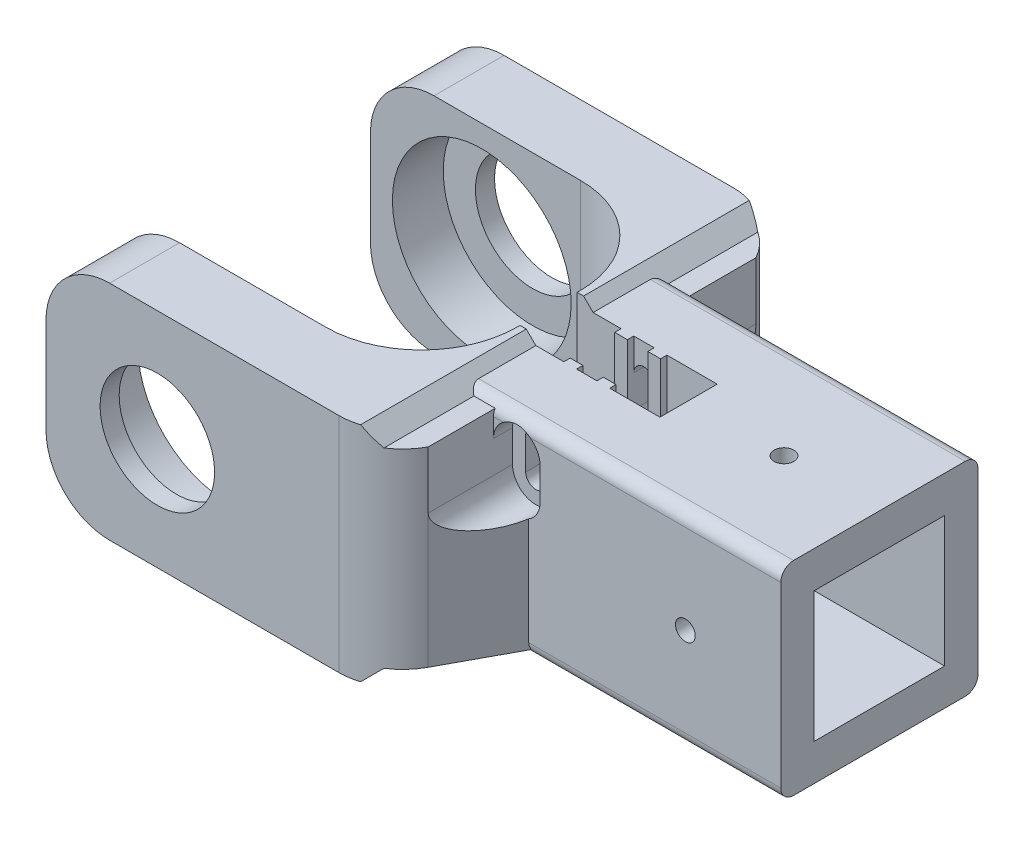
from build123d import *

# Parameters (mm, degrees)
SCHIZZO11_W                              = 14.5
SCHIZZO11_H                              = 15
ESTRUSIONE_ESTRUSIONE4_DEPTH             = 29
SCHIZZO12_W                              = 20.5
SCHIZZO12_H                              = 20.5
TAGLIO_ESTRUSIONE5_DEPTH                 = 31
SCHIZZO13_R                              = 1.5
TAGLIO_ESTRUSIONE6_DEPTH                 = 47.489246068
TAGLIO_ESTRUSIONE7_DEPTH                 = 39.551913052
TAGLIO_ESTRUSIONE7_DEPTH_BACK            = 39.551913052
SCHIZZO14_R                              = 1.5
RACCORDO6_R                              = 2
SCHIZZO15_W                              = 62
SCHIZZO15_H                              = 35
ESTRUSIONE_ESTRUSIONE5_DEPTH             = 2
SCHIZZO16_W                              = 11
SCHIZZO16_H                              = 35
ESTRUSIONE_ESTRUSIONE6_DEPTH             = 50
SCHIZZO19_R                              = 14.05
TAGLIO_ESTRUSIONE8_DEPTH                 = 8
TAGLIO_ESTRUSIONE9_DEPTH                 = 89.755281533
TAGLIO_ESTRUSIONE9_DEPTH_BACK            = 89.755281533
SCHIZZO20_R                              = 9
ESTRUSIONE_ESTRUSIONE7_DEPTH             = 35
ESTRUSIONE_ESTRUSIONE8_REACH             = 91.982
SMUSSO1_SIZE                             = 3
RACCORDO8_R                              = 10
RACCORDO9_R                              = 10
SCHIZZO24_W                              = 31
SCHIZZO24_H                              = 32
SCHIZZO24_W_2                            = 20.5
SCHIZZO24_H_2                            = 20.5
ESTRUSIONE_ESTRUSIONE9_DEPTH             = 15
ESTRUSIONE_ESTRUSIONE9_DIRECTION_2_REACH = 99.987
TAGLIO_ESTRUSIONE11_DEPTH                = 91.347938549
TAGLIO_ESTRUSIONE11_DEPTH_BACK           = 91.347938549
SCHIZZO25_R                              = 1.55
TAGLIO_ESTRUSIONE12_DEPTH                = 87.248188387
TAGLIO_ESTRUSIONE12_DEPTH_BACK           = 87.248188387
SCHIZZO26_R                              = 1.55
ESTRUSIONE_ESTRUSIONE10_DEPTH            = 25.75
SCHIZZO32_W                              = 22
SCHIZZO32_H                              = 32
ESTRUSIONE_ESTRUSIONE11_DEPTH            = 31
TAGLIO_ESTRUSIONE10_DEPTH                = 4.5
TAGLIO_ESTRUSIONE10_DEPTH_BACK           = 4.5
TAGLIO_ESTRUSIONE13_DEPTH                = 87.248188387
TAGLIO_ESTRUSIONE13_DEPTH_BACK           = 87.248188387
SCHIZZO29_R                              = 1.6
TAGLIO_ESTRUSIONE14_DEPTH                = 87.248188387
TAGLIO_ESTRUSIONE14_DEPTH_BACK           = 2
TAGLIO_ESTRUSIONE15_DEPTH                = 87.248188387
TAGLIO_ESTRUSIONE15_DEPTH_BACK           = 3
SCHIZZO33_W                              = 7.329913886
SCHIZZO33_H                              = 6.5
TAGLIO_ESTRUSIONE16_DEPTH                = 87.248188387
SCHIZZO34_W                              = 2
SCHIZZO34_H                              = 13.664956943
ESTRUSIONE_ESTRUSIONE12_DEPTH            = 1
RACCORDO10_R                             = 2


with BuildPart() as part:
    # Schizzo11 → Estrusione-Estrusione4 (new body)
    with BuildSketch(Plane.XY):
        Polygon((-14.5, 15), (14.5, -15), (-14.5, -15), (-20.5, -15), (-20.5, 15), align=None)
        Polygon((0, 15), (-14.5, 15), (0, 0), align=None)
        with Locations((7.25, 7.5)):
            Rectangle(SCHIZZO11_W, SCHIZZO11_H)
        Polygon((14.5, 0), (0, 0), (14.5, -15), align=None)
    extrude(amount=ESTRUSIONE_ESTRUSIONE4_DEPTH)

    # Schizzo12 → Taglio-Estrusione5 (cut)
    with BuildSketch(Plane(origin=(14.5, 0, 0), x_dir=(0, 0, -1), z_dir=(1, 0, 0))):
        with Locations((-14.5, 0)):
            Rectangle(SCHIZZO12_W, SCHIZZO12_H)
    extrude(amount=-TAGLIO_ESTRUSIONE5_DEPTH, mode=Mode.SUBTRACT)

    # Schizzo13 → Taglio-Estrusione6 (cut, through all)
    with BuildSketch(Plane.XZ.offset(15)):
        with Locations(Location((0, 14.5, 0), (0, 0, 270))):
            Circle(SCHIZZO13_R)
    extrude(amount=-TAGLIO_ESTRUSIONE6_DEPTH, mode=Mode.SUBTRACT)

    # Schizzo14 → Taglio-Estrusione7 (cut, two sides: drawn at the far end of the back side and taken through both)
    with BuildSketch(Plane.XY.offset(29).offset(-TAGLIO_ESTRUSIONE7_DEPTH_BACK)):
        Circle(SCHIZZO14_R)
    extrude(amount=TAGLIO_ESTRUSIONE7_DEPTH + TAGLIO_ESTRUSIONE7_DEPTH_BACK, mode=Mode.SUBTRACT)

    # Raccordo6
    raccordo6_edges = [part.edges().sort_by_distance(p)[0] for p in [
        (-3, 15, 29),
        (-3, -15, 29),
        (-3, -15, 0),
        (-3, 15, 0),
    ]]
    fillet(raccordo6_edges, radius=RACCORDO6_R)

    # Schizzo15 → Estrusione-Estrusione5 (add)
    with BuildSketch(Plane.ZY.offset(20.5)):
        with Locations((14.5, 0)):
            Rectangle(SCHIZZO15_W, SCHIZZO15_H)
    extrude(amount=-ESTRUSIONE_ESTRUSIONE5_DEPTH)

    # Schizzo16 → Estrusione-Estrusione6 (add)
    with BuildSketch(Plane.ZY.offset(20.5)):
        with Locations((-11, 0)):
            Rectangle(SCHIZZO16_W, SCHIZZO16_H)
        with Locations((40, 0)):
            Rectangle(SCHIZZO16_W, SCHIZZO16_H)
    extrude(amount=ESTRUSIONE_ESTRUSIONE6_DEPTH)

    # Schizzo19 → Taglio-Estrusione8 (cut)
    with BuildSketch(Plane(origin=(0, 0, 34.5), x_dir=(-1, 0, 0), z_dir=(0, 0, -1))):
        with Locations((53, 0)):
            Circle(SCHIZZO19_R)
    taglio_estrusione8 = extrude(amount=-TAGLIO_ESTRUSIONE8_DEPTH, mode=Mode.SUBTRACT)

    # Schizzo20 → Taglio-Estrusione9 (cut, two sides: drawn at the far end of the back side and taken through both)
    with BuildSketch(Plane(origin=(0, 0, 34.5), x_dir=(-1, 0, 0), z_dir=(0, 0, -1)).offset(-TAGLIO_ESTRUSIONE9_DEPTH_BACK)):
        with Locations((53, 0)):
            Circle(SCHIZZO20_R)
    extrude(amount=TAGLIO_ESTRUSIONE9_DEPTH + TAGLIO_ESTRUSIONE9_DEPTH_BACK, mode=Mode.SUBTRACT)

    # Specchia1: Taglio-Estrusione8 across plane
    add(taglio_estrusione8.mirror(Plane(origin=(0, 0, 14.5), x_dir=(1, 0, 0), z_dir=(0, 0, -1))), mode=Mode.SUBTRACT)

    # Schizzo21 → Estrusione-Estrusione7 (add)
    with BuildSketch(Plane.XZ.offset(17.5)):
        with BuildLine():
            ThreePointArc((-37.5, 34.5), (-26.893398282, 30.106601718), (-22.5, 19.5))
            Line((-22.5, 19.5), (-22.5, 34.5))
            Line((-22.5, 34.5), (-37.5, 34.5))
        make_face()
        with BuildLine():
            Line((-37.5, -5.5), (-22.5, -5.5))
            Line((-22.5, -5.5), (-22.5, 9.5))
            ThreePointArc((-22.5, 9.5), (-26.893398282, -1.106601718), (-37.5, -5.5))
        make_face()
        Polygon((-22.5, 9.5), (-22.5, -5.5), (-20.5, -5.5), (-20.5, 34.5), (-22.5, 34.5), (-22.5, 19.5), align=None)
    extrude(amount=-ESTRUSIONE_ESTRUSIONE7_DEPTH)

    # Estrusione-Estrusione8: up to this face of the body (flat: up to its plane)
    estrusione_estrusione8_end = Plane(part.part.faces().sort_by_distance((-2.017284049, 15, 14.5))[0])
    # Schizzo22 → Estrusione-Estrusione8 (add, up to the picked face)
    with BuildSketch(Plane.XZ.offset(15), mode=Mode.PRIVATE) as estrusione_estrusione8_sk1:
        Polygon((-18.5, 27), (-8.5, 27), (-18.5, 45.5), align=None)
    estrusione_estrusione8_tool1 = split(extrude(estrusione_estrusione8_sk1.sketch, amount=-ESTRUSIONE_ESTRUSIONE8_REACH, mode=Mode.PRIVATE), bisect_by=estrusione_estrusione8_end, keep=Keep.BOTH, mode=Mode.PRIVATE)
    # Schizzo22 → Estrusione-Estrusione8 (add, up to the picked face)
    with BuildSketch(Plane.XZ.offset(15), mode=Mode.PRIVATE) as estrusione_estrusione8_sk2:
        Polygon((-18.5, 2), (-18.5, -16.5), (-8.5, 2), align=None)
    estrusione_estrusione8_tool2 = split(extrude(estrusione_estrusione8_sk2.sketch, amount=-ESTRUSIONE_ESTRUSIONE8_REACH, mode=Mode.PRIVATE), bisect_by=estrusione_estrusione8_end, keep=Keep.BOTH, mode=Mode.PRIVATE)
    add(estrusione_estrusione8_tool1.solids().sort_by(Axis((-15.166667, -15, 33.166667), (0, 1, 0)))[0])
    add(estrusione_estrusione8_tool2.solids().sort_by(Axis((-15.166667, -15, -4.166667), (0, 1, 0)))[0])

    # Smusso1
    # the kernel refuses this chamfer: 3 mm, written as the material it takes off along each edge
    with BuildSketch(Plane(origin=(-18.5, -17.5, 53.215048964), x_dir=(-0.9996219169112965, -0.02749587661058676, 0), z_dir=(0, 0, -1))) as smusso1_piece_1_section:
        Polygon((SMUSSO1_SIZE * 0.999621916911, SMUSSO1_SIZE * 0.0274958766106), (-SMUSSO1_SIZE * 0.0274958766106, SMUSSO1_SIZE * 0.999621916911), (0, 0), align=None)
    smusso1_piece_1 = extrude(amount=77.430097928, mode=Mode.PRIVATE)
    smusso1_piece_1 = split(smusso1_piece_1, bisect_by=Plane(origin=(-19.526079574, -15, 14.5), z_dir=(0, -1, 0)), keep=Keep.TOP, mode=Mode.PRIVATE)
    add(smusso1_piece_1, mode=Mode.SUBTRACT)
    with BuildSketch(Plane(origin=(-18.5, 17.5, -24.215048964), x_dir=(-0.9996219169112965, 0.02749587661058676, 0), z_dir=(0, 0, 1))) as smusso1_piece_2_section:
        Polygon((SMUSSO1_SIZE * 0.999621916911, SMUSSO1_SIZE * 0.0274958766106), (-SMUSSO1_SIZE * 0.0274958766106, SMUSSO1_SIZE * 0.999621916911), (0, 0), align=None)
    smusso1_piece_2 = extrude(amount=77.430097928, mode=Mode.PRIVATE)
    smusso1_piece_2 = split(smusso1_piece_2, bisect_by=Plane(origin=(-19.526079574, 15, 14.5), z_dir=(0, 1, 0)), keep=Keep.TOP, mode=Mode.PRIVATE)
    add(smusso1_piece_2, mode=Mode.SUBTRACT)

    # Raccordo8
    raccordo8_edges = [part.edges().sort_by_distance(p)[0] for p in [
        (-18.5, 0, 45.5),
        (-18.5, 0, -16.5),
    ]]
    fillet(raccordo8_edges, radius=RACCORDO8_R)

    # Raccordo9
    raccordo9_edges = [part.edges().sort_by_distance(p)[0] for p in [
        (-70.5, -17.5, -11),
        (-70.5, 17.5, -11),
        (-70.5, 17.5, 40),
        (-70.5, -17.5, 40),
    ]]
    fillet(raccordo9_edges, radius=RACCORDO9_R)

    # Schizzo24 → Estrusione-Estrusione9 (add)
    with BuildSketch(Plane(origin=(14.5, 0, 0), x_dir=(0, 0, -1), z_dir=(1, 0, 0))):
        with Locations((-14.5, 0)):
            Rectangle(SCHIZZO24_W, SCHIZZO24_H)
        with Locations((-14.5, 0)):
            Rectangle(SCHIZZO24_W_2, SCHIZZO24_H_2, mode=Mode.SUBTRACT)
    extrude(amount=ESTRUSIONE_ESTRUSIONE9_DEPTH)

    # Estrusione-Estrusione9 direction 2: up to this face of the body (flat: up to its plane)
    estrusione_estrusione9_direction_2_end = Plane(part.part.faces().sort_by_distance((-22.5, 0, 14.5))[0])
    # Schizzo24 → Estrusione-Estrusione9 direction 2 (add, up to the picked face)
    with BuildSketch(Plane(origin=(14.5, 0, 0), x_dir=(0, 0, -1), z_dir=(1, 0, 0)), mode=Mode.PRIVATE) as estrusione_estrusione9_direction_2_sk1:
        with Locations((-14.5, 0)):
            Rectangle(SCHIZZO24_W, SCHIZZO24_H)
        with Locations((-14.5, 0)):
            Rectangle(SCHIZZO24_W_2, SCHIZZO24_H_2, mode=Mode.SUBTRACT)
    estrusione_estrusione9_direction_2_tool1 = split(extrude(estrusione_estrusione9_direction_2_sk1.sketch, amount=-ESTRUSIONE_ESTRUSIONE9_DIRECTION_2_REACH, mode=Mode.PRIVATE), bisect_by=estrusione_estrusione9_direction_2_end, keep=Keep.BOTH, mode=Mode.PRIVATE)
    add(estrusione_estrusione9_direction_2_tool1.solids().sort_by(Axis((14.5, -15.554467, 14.5), (-1, 0, 0)))[0])

    # Schizzo25 → Taglio-Estrusione11 (cut, two sides: drawn at the far end of the back side and taken through both)
    with BuildSketch(Plane(origin=(0, 16, 0), x_dir=(1, 0, 0), z_dir=(0, 1, 0)).offset(-TAGLIO_ESTRUSIONE11_DEPTH_BACK)):
        with Locations(Location((14.5, -14.5, 0), (0, 0, 90))):
            Circle(SCHIZZO25_R)
    extrude(amount=TAGLIO_ESTRUSIONE11_DEPTH + TAGLIO_ESTRUSIONE11_DEPTH_BACK, mode=Mode.SUBTRACT)

    # Schizzo26 → Taglio-Estrusione12 (cut, two sides: drawn at the far end of the back side and taken through both)
    with BuildSketch(Plane(origin=(0, 0, -1), x_dir=(-1, 0, 0), z_dir=(0, 0, -1)).offset(-TAGLIO_ESTRUSIONE12_DEPTH_BACK)):
        with Locations((-14.5, 0)):
            Circle(SCHIZZO26_R)
    extrude(amount=TAGLIO_ESTRUSIONE12_DEPTH + TAGLIO_ESTRUSIONE12_DEPTH_BACK, mode=Mode.SUBTRACT)

    # Schizzo28 → Estrusione-Estrusione10 (add)
    with BuildSketch(Plane(origin=(0, 0, -1), x_dir=(-1, 0, 0), z_dir=(0, 0, -1))):
        with BuildLine():
            ThreePointArc((10.121621622, -5.345558367), (3.229271656, -1.438032288), (0.5, 6))
            Line((0.5, 6), (0.5, -16))
            Line((0.5, -16), (20, -16))
            Line((20, -16), (19, -15))
            Line((19, -15), (10.121621622, -15))
            Line((10.121621622, -15), (10.121621622, -5.345558367))
        make_face()
        with BuildLine():
            ThreePointArc((20, -2.261355821), (15.427337036, -4.977402281), (10.121621622, -5.345558367))
            Line((10.121621622, -5.345558367), (10.121621622, -15))
            Line((10.121621622, -15), (19, -15))
            Line((19, -15), (20, -16))
            Line((20, -16), (20, -2.261355821))
        make_face()
    extrude(amount=-ESTRUSIONE_ESTRUSIONE10_DEPTH)

    # Schizzo32 → Estrusione-Estrusione11 (add)
    with BuildSketch(Plane.XY.offset(30)):
        with Locations((-11.5, 0)):
            Rectangle(SCHIZZO32_W, SCHIZZO32_H)
    extrude(amount=-ESTRUSIONE_ESTRUSIONE11_DEPTH)

    # Schizzo23 → Taglio-Estrusione10 (cut, two sides: drawn at the far end of the back side and taken through both)
    with BuildSketch(Plane(origin=(0, 0, 14.5), x_dir=(-1, 0, 0), z_dir=(0, 0, -1)).offset(-TAGLIO_ESTRUSIONE10_DEPTH_BACK)):
        with BuildLine():
            Line((0.5, 17.5), (0.5, 6))
            ThreePointArc((0.5, 6), (12, -5.5), (23.5, 6))
            Line((23.5, 6), (24.462022078, 17.5))
            Line((24.462022078, 17.5), (0.5, 17.5))
        make_face()
    extrude(amount=TAGLIO_ESTRUSIONE10_DEPTH + TAGLIO_ESTRUSIONE10_DEPTH_BACK, mode=Mode.SUBTRACT)

    # Schizzo29 → Taglio-Estrusione13 (cut, two sides: drawn at the far end of the back side and taken through both)
    with BuildSketch(Plane(origin=(0, 0, -1), x_dir=(-1, 0, 0), z_dir=(0, 0, -1)).offset(-TAGLIO_ESTRUSIONE13_DEPTH_BACK)):
        with Locations((12, 6)):
            Circle(SCHIZZO29_R)
        with BuildLine():
            Line((10.4, 11), (10.4, 6))
            ThreePointArc((10.4, 6), (12, 7.6), (13.6, 6))
            Line((13.6, 6), (13.6, 11))
            ThreePointArc((13.6, 11), (12, 9.4), (10.4, 11))
        make_face()
        with Locations((12, 11)):
            Circle(SCHIZZO29_R)
    extrude(amount=TAGLIO_ESTRUSIONE13_DEPTH + TAGLIO_ESTRUSIONE13_DEPTH_BACK, mode=Mode.SUBTRACT)

    # Schizzo30 → Taglio-Estrusione14 (cut, two sides: drawn at the far end of the back side and taken through both)
    with BuildSketch(Plane(origin=(0, 0, -1), x_dir=(-1, 0, 0), z_dir=(0, 0, -1)).offset(-TAGLIO_ESTRUSIONE14_DEPTH_BACK)):
        with BuildLine():
            Line((8.335043057, 6), (8.335043057, 11))
            ThreePointArc((8.335043057, 11), (12, 14.664956943), (15.664956943, 11))
            Line((15.664956943, 11), (15.664956943, 6))
            ThreePointArc((15.664956943, 6), (12, 2.335043057), (8.335043057, 6))
        make_face()
        with BuildLine():
            Line((13.6, 11), (13.6, 6))
            ThreePointArc((13.6, 6), (12, 4.4), (10.4, 6))
            Line((10.4, 6), (10.4, 11))
            ThreePointArc((10.4, 11), (12, 12.6), (13.6, 11))
        make_face(mode=Mode.SUBTRACT)
    extrude(amount=TAGLIO_ESTRUSIONE14_DEPTH + TAGLIO_ESTRUSIONE14_DEPTH_BACK, mode=Mode.SUBTRACT)

    # Schizzo31 → Taglio-Estrusione15 (cut, two sides: drawn at the far end of the back side and taken through both)
    with BuildSketch(Plane.XY.offset(30).offset(-TAGLIO_ESTRUSIONE15_DEPTH_BACK)):
        with BuildLine():
            Line((-8.335043057, 11), (-8.335043057, 6))
            ThreePointArc((-8.335043057, 6), (-12, 2.335043057), (-15.664956943, 6))
            Line((-15.664956943, 6), (-15.664956943, 11))
            ThreePointArc((-15.664956943, 11), (-12, 14.664956943), (-8.335043057, 11))
        make_face()
        with BuildLine():
            Line((-13.6, 6), (-13.6, 11))
            ThreePointArc((-13.6, 11), (-12, 12.6), (-10.4, 11))
            Line((-10.4, 11), (-10.4, 6))
            ThreePointArc((-10.4, 6), (-12, 4.4), (-13.6, 6))
        make_face(mode=Mode.SUBTRACT)
    extrude(amount=TAGLIO_ESTRUSIONE15_DEPTH + TAGLIO_ESTRUSIONE15_DEPTH_BACK, mode=Mode.SUBTRACT)

    # Schizzo33 → Taglio-Estrusione16 (cut, through all)
    with BuildSketch(Plane.XY.offset(30)):
        with Locations((-12, 11.75)):
            Rectangle(SCHIZZO33_W, SCHIZZO33_H)
    taglio_estrusione16 = extrude(amount=TAGLIO_ESTRUSIONE16_DEPTH, mode=Mode.SUBTRACT)

    # Specchia2: Taglio-Estrusione16 across plane
    add(taglio_estrusione16.mirror(Plane(origin=(0, 0, 14.5), x_dir=(1, 0, 0), z_dir=(0, 0, -1))), mode=Mode.SUBTRACT)

    # Schizzo34 → Estrusione-Estrusione12 (add)
    with BuildSketch(Plane.XY.offset(10)):
        with Locations((-9.4, 9.167521529)):
            Rectangle(SCHIZZO34_W, SCHIZZO34_H)
        with Locations((-14.6, 9.167521529)):
            Rectangle(SCHIZZO34_W, SCHIZZO34_H)
    estrusione_estrusione12 = extrude(amount=ESTRUSIONE_ESTRUSIONE12_DEPTH)

    # Specchia3: Estrusione-Estrusione12 across plane
    add(estrusione_estrusione12.mirror(Plane(origin=(0, 0, 14.5), x_dir=(1, 0, 0), z_dir=(0, 0, -1))))

    # Raccordo10
    # the kernel refuses this fillet: 2 mm, written as the material it takes off along each edge
    with BuildSketch(Plane(origin=(34.5, -16, 30), x_dir=(0, 0, -1), z_dir=(-1, 0, 0))) as raccordo10_piece_1_section:
        with BuildLine():
            CenterArc((RACCORDO10_R, -RACCORDO10_R), RACCORDO10_R, 90, 90)
            Line((0, -RACCORDO10_R), (0, 0))
            Line((0, 0), (RACCORDO10_R, 0))
        make_face()
    raccordo10_piece_1 = extrude(amount=59.5, mode=Mode.PRIVATE)
    raccordo10_piece_1 = split(raccordo10_piece_1, bisect_by=Plane(origin=(12.32648225, -15, 29.492015668), z_dir=(0, -1, 0)), keep=Keep.TOP, mode=Mode.PRIVATE)
    raccordo10_piece_1 = split(raccordo10_piece_1, bisect_by=Plane(origin=(-4.83323838, -15.670403745, 20.216491003), z_dir=(0.879706513576127, 0, 0.4755170343654742)), keep=Keep.TOP, mode=Mode.PRIVATE)
    add(raccordo10_piece_1, mode=Mode.SUBTRACT)
    with BuildSketch(Plane(origin=(34.5, -16, 30), x_dir=(0, 0, -1), z_dir=(-1, 0, 0))) as raccordo10_piece_2_section:
        with BuildLine():
            CenterArc((RACCORDO10_R, -RACCORDO10_R), RACCORDO10_R, 90, 90)
            Line((0, -RACCORDO10_R), (0, 0))
            Line((0, 0), (RACCORDO10_R, 0))
        make_face()
    raccordo10_piece_2 = extrude(amount=59.5, mode=Mode.PRIVATE)
    raccordo10_piece_2 = split(raccordo10_piece_2, bisect_by=Plane(origin=(12.202151149, -15, 29.952040751), z_dir=(0, 1, 0)), keep=Keep.TOP, mode=Mode.PRIVATE)
    raccordo10_piece_2 = split(raccordo10_piece_2, bisect_by=Plane(origin=(-5.053787279, -14.67337716, 20.624506465), z_dir=(0.879706513576127, 0, 0.4755170343654742)), keep=Keep.TOP, mode=Mode.PRIVATE)
    add(raccordo10_piece_2, mode=Mode.SUBTRACT)
    with BuildSketch(Plane(origin=(34.5, -16, 30), x_dir=(0, 0, -1), z_dir=(-1, 0, 0))) as raccordo10_piece_3_section:
        with BuildLine():
            CenterArc((RACCORDO10_R, -RACCORDO10_R), RACCORDO10_R, 90, 90)
            Line((0, -RACCORDO10_R), (0, 0))
            Line((0, 0), (RACCORDO10_R, 0))
        make_face()
    raccordo10_piece_3 = extrude(amount=59.5, mode=Mode.PRIVATE)
    raccordo10_piece_3 = split(raccordo10_piece_3, bisect_by=Plane(origin=(-17.22137525, -13.22137525, 29.472792571), z_dir=(0.7071067811868302, -0.7071067811862648, 0)), keep=Keep.TOP, mode=Mode.PRIVATE)
    raccordo10_piece_3 = split(raccordo10_piece_3, bisect_by=Plane(origin=(-14.759798379, -15, 29.472792571), z_dir=(0, -1, 0)), keep=Keep.TOP, mode=Mode.PRIVATE)
    raccordo10_piece_3 = split(raccordo10_piece_3, bisect_by=Plane(origin=(-10.949850681, -15.682952121, 31.532223759), z_dir=(-0.879706513576127, 0, -0.4755170343654742)), keep=Keep.TOP, mode=Mode.PRIVATE)
    add(raccordo10_piece_3, mode=Mode.SUBTRACT)
    with BuildSketch(Plane(origin=(34.5, -16, -1), x_dir=(0, 1, 0), z_dir=(-1, 0, 0))) as raccordo10_piece_4_section:
        with BuildLine():
            CenterArc((RACCORDO10_R, -RACCORDO10_R), RACCORDO10_R, 90, 90)
            Line((0, -RACCORDO10_R), (0, 0))
            Line((0, 0), (RACCORDO10_R, 0))
        make_face()
    raccordo10_piece_4 = extrude(amount=59.5, mode=Mode.PRIVATE)
    raccordo10_piece_4 = split(raccordo10_piece_4, bisect_by=Plane(origin=(12.202151149, -15, -0.952040751), z_dir=(0, 1, 0)), keep=Keep.TOP, mode=Mode.PRIVATE)
    raccordo10_piece_4 = split(raccordo10_piece_4, bisect_by=Plane(origin=(-5.053787279, -14.67337716, 8.375493534), z_dir=(0.879706513576127, 0, -0.4755170343654743)), keep=Keep.TOP, mode=Mode.PRIVATE)
    add(raccordo10_piece_4, mode=Mode.SUBTRACT)
    with BuildSketch(Plane(origin=(34.5, -16, -1), x_dir=(0, 1, 0), z_dir=(-1, 0, 0))) as raccordo10_piece_5_section:
        with BuildLine():
            CenterArc((RACCORDO10_R, -RACCORDO10_R), RACCORDO10_R, 90, 90)
            Line((0, -RACCORDO10_R), (0, 0))
            Line((0, 0), (RACCORDO10_R, 0))
        make_face()
    raccordo10_piece_5 = extrude(amount=59.5, mode=Mode.PRIVATE)
    raccordo10_piece_5 = split(raccordo10_piece_5, bisect_by=Plane(origin=(12.326482252, -15, -0.492015668), z_dir=(0, -1, 0)), keep=Keep.TOP, mode=Mode.PRIVATE)
    raccordo10_piece_5 = split(raccordo10_piece_5, bisect_by=Plane(origin=(-4.83323838, -15.670403745, 8.783508998), z_dir=(0.879706513576127, 0, -0.4755170343654743)), keep=Keep.TOP, mode=Mode.PRIVATE)
    add(raccordo10_piece_5, mode=Mode.SUBTRACT)
    with BuildSketch(Plane(origin=(34.5, -16, -1), x_dir=(0, 1, 0), z_dir=(-1, 0, 0))) as raccordo10_piece_6_section:
        with BuildLine():
            CenterArc((RACCORDO10_R, -RACCORDO10_R), RACCORDO10_R, 90, 90)
            Line((0, -RACCORDO10_R), (0, 0))
            Line((0, 0), (RACCORDO10_R, 0))
        make_face()
    raccordo10_piece_6 = extrude(amount=59.5, mode=Mode.PRIVATE)
    raccordo10_piece_6 = split(raccordo10_piece_6, bisect_by=Plane(origin=(-17.221375249, -13.221375249, -0.472792571), z_dir=(0.7071067811868302, -0.7071067811862648, 0)), keep=Keep.TOP, mode=Mode.PRIVATE)
    raccordo10_piece_6 = split(raccordo10_piece_6, bisect_by=Plane(origin=(-14.759798377, -15, -0.472792571), z_dir=(0, -1, 0)), keep=Keep.TOP, mode=Mode.PRIVATE)
    raccordo10_piece_6 = split(raccordo10_piece_6, bisect_by=Plane(origin=(-10.94985068, -15.682952121, -2.532223758), z_dir=(-0.879706513576127, 0, 0.4755170343654743)), keep=Keep.TOP, mode=Mode.PRIVATE)
    add(raccordo10_piece_6, mode=Mode.SUBTRACT)
    with BuildSketch(Plane(origin=(34.5, 16, 30), x_dir=(0, -1, 0), z_dir=(-1, 0, 0))) as raccordo10_piece_7_section:
        with BuildLine():
            CenterArc((RACCORDO10_R, -RACCORDO10_R), RACCORDO10_R, 90, 90)
            Line((0, -RACCORDO10_R), (0, 0))
            Line((0, 0), (RACCORDO10_R, 0))
        make_face()
    raccordo10_piece_7 = extrude(amount=59.5, mode=Mode.PRIVATE)
    raccordo10_piece_7 = split(raccordo10_piece_7, bisect_by=Plane(origin=(9.417521529, 15, 29.951983237), z_dir=(0, -1, 0)), keep=Keep.TOP, mode=Mode.PRIVATE)
    raccordo10_piece_7 = split(raccordo10_piece_7, bisect_by=Plane(origin=(-15.664956943, 14.673498431, 29.951983237), z_dir=(1, 0, 0)), keep=Keep.TOP, mode=Mode.PRIVATE)
    add(raccordo10_piece_7, mode=Mode.SUBTRACT)
    with BuildSketch(Plane(origin=(34.5, 16, 30), x_dir=(0, -1, 0), z_dir=(-1, 0, 0))) as raccordo10_piece_8_section:
        with BuildLine():
            CenterArc((RACCORDO10_R, -RACCORDO10_R), RACCORDO10_R, 90, 90)
            Line((0, -RACCORDO10_R), (0, 0))
            Line((0, 0), (RACCORDO10_R, 0))
        make_face()
    raccordo10_piece_8 = extrude(amount=59.5, mode=Mode.PRIVATE)
    raccordo10_piece_8 = split(raccordo10_piece_8, bisect_by=Plane(origin=(9.417521529, 15, 29.48975988), z_dir=(0, 1, 0)), keep=Keep.TOP, mode=Mode.PRIVATE)
    raccordo10_piece_8 = split(raccordo10_piece_8, bisect_by=Plane(origin=(-15.664956943, 15.671216471, 29.48975988), z_dir=(1, 0, 0)), keep=Keep.TOP, mode=Mode.PRIVATE)
    add(raccordo10_piece_8, mode=Mode.SUBTRACT)
    with BuildSketch(Plane(origin=(34.5, 16, 30), x_dir=(0, -1, 0), z_dir=(-1, 0, 0))) as raccordo10_piece_9_section:
        with BuildLine():
            CenterArc((RACCORDO10_R, -RACCORDO10_R), RACCORDO10_R, 90, 90)
            Line((0, -RACCORDO10_R), (0, 0))
            Line((0, 0), (RACCORDO10_R, 0))
        make_face()
    raccordo10_piece_9 = extrude(amount=59.5, mode=Mode.PRIVATE)
    raccordo10_piece_9 = split(raccordo10_piece_9, bisect_by=Plane(origin=(-18.684490828, 14.684490828, 29.473116962), z_dir=(0.7071067811868302, 0.7071067811862648, 0)), keep=Keep.TOP, mode=Mode.PRIVATE)
    raccordo10_piece_9 = split(raccordo10_piece_9, bisect_by=Plane(origin=(-17.677979533, 15, 29.473116962), z_dir=(0, 1, 0)), keep=Keep.TOP, mode=Mode.PRIVATE)
    raccordo10_piece_9 = split(raccordo10_piece_9, bisect_by=Plane(origin=(-15.664956943, 15.691002123, 29.473116962), z_dir=(-1, 0, 0)), keep=Keep.TOP, mode=Mode.PRIVATE)
    add(raccordo10_piece_9, mode=Mode.SUBTRACT)
    with BuildSketch(Plane(origin=(-25, 16, -1), x_dir=(0, -1, 0), z_dir=(1, 0, 0))) as raccordo10_piece_10_section:
        with BuildLine():
            CenterArc((RACCORDO10_R, -RACCORDO10_R), RACCORDO10_R, 90, 90)
            Line((0, -RACCORDO10_R), (0, 0))
            Line((0, 0), (RACCORDO10_R, 0))
        make_face()
    raccordo10_piece_10 = extrude(amount=59.5, mode=Mode.PRIVATE)
    raccordo10_piece_10 = split(raccordo10_piece_10, bisect_by=Plane(origin=(-15.664956943, 15.691002123, -0.473116962), z_dir=(-1, 0, 0)), keep=Keep.TOP, mode=Mode.PRIVATE)
    raccordo10_piece_10 = split(raccordo10_piece_10, bisect_by=Plane(origin=(-17.677979533, 15, -0.473116962), z_dir=(0, 1, 0)), keep=Keep.TOP, mode=Mode.PRIVATE)
    raccordo10_piece_10 = split(raccordo10_piece_10, bisect_by=Plane(origin=(-18.684490828, 14.684490828, -0.473116962), z_dir=(0.7071067811868302, 0.7071067811862648, 0)), keep=Keep.TOP, mode=Mode.PRIVATE)
    add(raccordo10_piece_10, mode=Mode.SUBTRACT)
    with BuildSketch(Plane(origin=(-25, 16, -1), x_dir=(0, -1, 0), z_dir=(1, 0, 0))) as raccordo10_piece_11_section:
        with BuildLine():
            CenterArc((RACCORDO10_R, -RACCORDO10_R), RACCORDO10_R, 90, 90)
            Line((0, -RACCORDO10_R), (0, 0))
            Line((0, 0), (RACCORDO10_R, 0))
        make_face()
    raccordo10_piece_11 = extrude(amount=59.5, mode=Mode.PRIVATE)
    raccordo10_piece_11 = split(raccordo10_piece_11, bisect_by=Plane(origin=(-15.664956943, 14.673498431, -0.951983237), z_dir=(1, 0, 0)), keep=Keep.TOP, mode=Mode.PRIVATE)
    raccordo10_piece_11 = split(raccordo10_piece_11, bisect_by=Plane(origin=(9.417521529, 15, -0.951983237), z_dir=(0, -1, 0)), keep=Keep.TOP, mode=Mode.PRIVATE)
    add(raccordo10_piece_11, mode=Mode.SUBTRACT)
    with BuildSketch(Plane(origin=(-25, 16, -1), x_dir=(0, -1, 0), z_dir=(1, 0, 0))) as raccordo10_piece_12_section:
        with BuildLine():
            CenterArc((RACCORDO10_R, -RACCORDO10_R), RACCORDO10_R, 90, 90)
            Line((0, -RACCORDO10_R), (0, 0))
            Line((0, 0), (RACCORDO10_R, 0))
        make_face()
    raccordo10_piece_12 = extrude(amount=59.5, mode=Mode.PRIVATE)
    raccordo10_piece_12 = split(raccordo10_piece_12, bisect_by=Plane(origin=(-15.664956943, 15.671216471, -0.48975988), z_dir=(1, 0, 0)), keep=Keep.TOP, mode=Mode.PRIVATE)
    raccordo10_piece_12 = split(raccordo10_piece_12, bisect_by=Plane(origin=(9.417521529, 15, -0.48975988), z_dir=(0, 1, 0)), keep=Keep.TOP, mode=Mode.PRIVATE)
    add(raccordo10_piece_12, mode=Mode.SUBTRACT)


solid = part.part
